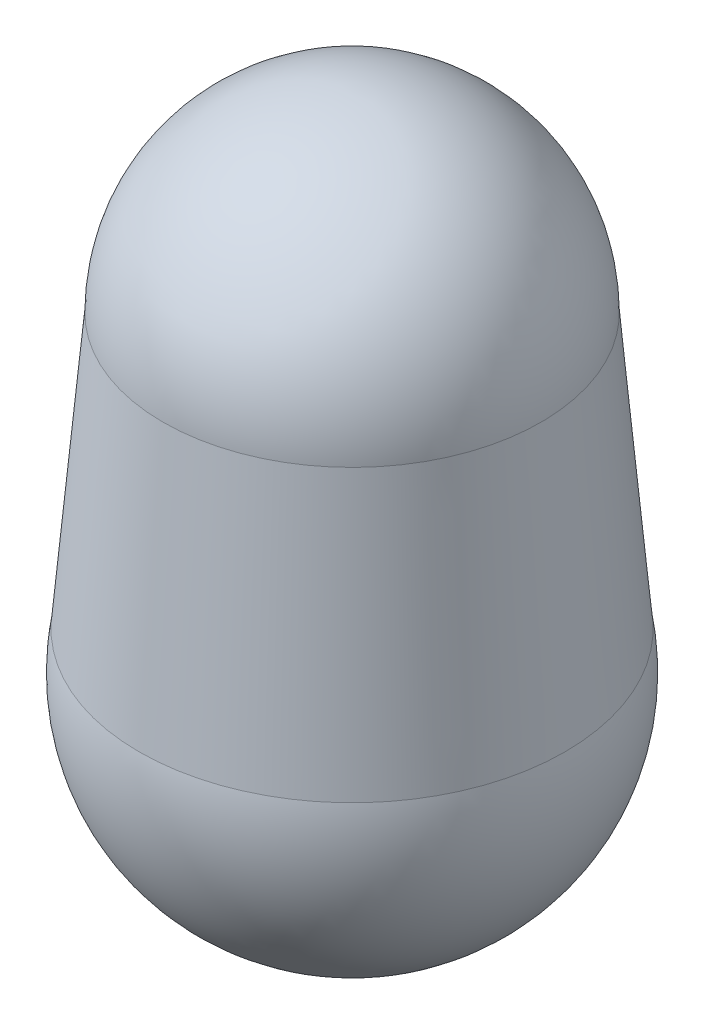
from build123d import *

# Parameters (mm, degrees)
SKETCH2_R           = 6.95
BOSS_EXTRUDE1_DEPTH = 10
BOSS_EXTRUDE1_TAPER = 5


with BuildPart() as part:
    # Sketch1 → Revolve1 (revolve)
    with BuildSketch(Plane(origin=(0, 0, 0), x_dir=(1, 0, 0), z_dir=(0, 1, 0))):
        with BuildLine():
            Line((0, 6.95), (0, -6.95))
            ThreePointArc((0, -6.95), (6.95, 0), (0, 6.95))
        make_face()
    revolve(axis=Axis((0, 0, -6.95), (0, 0, 1)))

    # Sketch2 → Boss-Extrude1 (add)
    with BuildSketch(Plane(origin=(0, 0, 0), x_dir=(1, 0, 0), z_dir=(0, 1, 0))):
        Circle(SKETCH2_R)
    extrude(amount=BOSS_EXTRUDE1_DEPTH, taper=BOSS_EXTRUDE1_TAPER)

    # Sketch3 → Revolve2 (revolve)
    with BuildSketch(Plane(origin=(0, 10, 0), x_dir=(1, 0, 0), z_dir=(0, 1, 0))):
        with BuildLine():
            Line((0, 6.075113365), (0, -6.075113365))
            ThreePointArc((0, -6.075113365), (6.075113365, 0), (0, 6.075113365))
        make_face()
    revolve(axis=Axis((0, 10, -6.075113365), (0, 0, 1)))


solid = part.part
